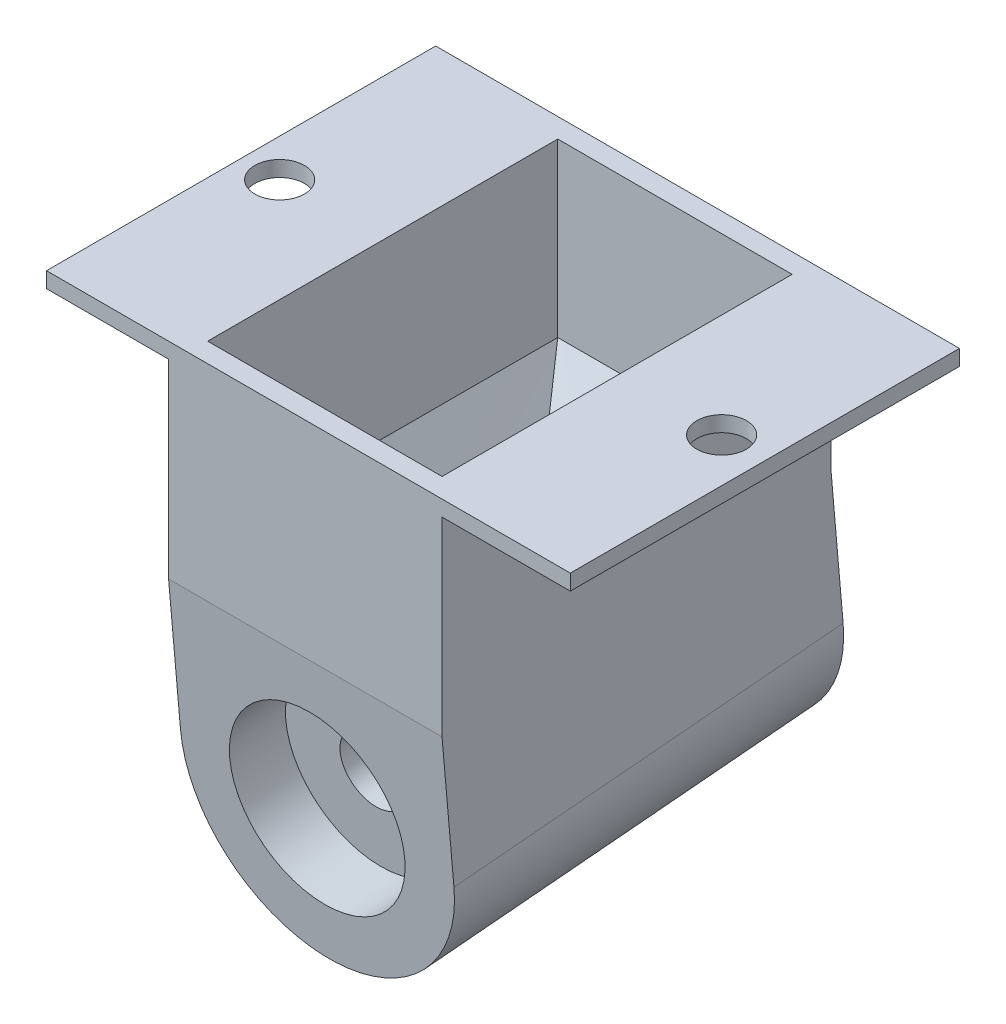
from build123d import *

# Parameters (mm, degrees)
BOSS_EXTRUDE2_DEPTH = 50
SKETCH19_R          = 4.25
CUT_EXTRUDE4_DEPTH  = 59.449844405
SKETCH20_R          = 11.2
CUT_EXTRUDE5_DEPTH  = 7.2
CUT_EXTRUDE6_START  = -7.2
SKETCH21_R          = 11.2
CUT_EXTRUDE6_DEPTH  = 7.2
SKETCH29_W          = 67.039204955
SKETCH29_H          = 49.809734905
SKETCH29_R          = 3.175
SKETCH29_W_2        = 30
SKETCH29_H_2        = 44.809734905
BOSS_EXTRUDE4_DEPTH = 2


with BuildPart() as part:
    # Sketch11 → Boss-Extrude2 (new body)
    with BuildSketch(Plane(origin=(0, 0, 0), x_dir=(-1, 0, 0), z_dir=(0, 0.08715574274765156, -0.9961946980917461))):
        with BuildLine():
            Line((-17.5, 0), (-17.5, 17.5))
            Line((-17.5, 17.5), (17.5, 17.5))
            Line((17.5, 17.5), (17.5, 0))
            ThreePointArc((17.5, 0), (0, -17.5), (-17.5, 0))
        make_face()
    extrude(amount=BOSS_EXTRUDE2_DEPTH)

    # Sketch19 → Cut-Extrude4 (cut, through all)
    with BuildSketch(Plane(origin=(0, 0, 0), x_dir=(1, 0, 0), z_dir=(0, -0.08715574274765156, 0.9961946980917461))):
        with Locations(Location((0, 0, 0), (0, 0, 270))):
            Circle(SKETCH19_R)
    extrude(amount=-CUT_EXTRUDE4_DEPTH, mode=Mode.SUBTRACT)

    # Sketch20 → Cut-Extrude5 (cut)
    with BuildSketch(Plane(origin=(0, 0, 0), x_dir=(1, 0, 0), z_dir=(0, -0.08715574274765156, 0.9961946980917461))):
        with Locations(Location((0, 0, 0), (0, 0, 270))):
            Circle(SKETCH20_R)
    extrude(amount=-CUT_EXTRUDE5_DEPTH, mode=Mode.SUBTRACT)

    # Sketch21 → Cut-Extrude6 (cut)
    with BuildSketch(Plane(origin=(0, 4.357787137, -49.809734905), x_dir=(-1, 0, 0), z_dir=(0, 0.08715574274765156, -0.9961946980917461)).offset(CUT_EXTRUDE6_START)):
        with Locations(Location((0, 0, 0), (0, 0, 270))):
            Circle(SKETCH21_R)
    extrude(amount=CUT_EXTRUDE6_DEPTH, mode=Mode.SUBTRACT)

    # Sketch23 → Loft3 section 0
    with BuildSketch(Plane(origin=(0, 17.433407217, 1.525225498), x_dir=(1, 0, 0), z_dir=(0, 0.9961946980917462, 0.08715574274765159))):
        with BuildLine():
            Line((17.5, 0), (17.5, 50))
            Line((17.5, 50), (-17.5, 50))
            Line((-17.5, 50), (-17.5, 0))
            Line((-17.5, 0), (17.5, 0))
        make_face()
    # Sketch24 → Loft3 section 1
    with BuildSketch(Plane(origin=(0, 41.791194354, 0), x_dir=(1, 0, 0), z_dir=(0, 1, 0))):
        with BuildLine():
            Line((17.5, -1.525225498), (17.5, 48.284509407))
            Line((17.5, 48.284509407), (-17.5, 48.284509407))
            Line((-17.5, 48.284509407), (-17.5, -1.525225498))
            Line((-17.5, -1.525225498), (17.5, -1.525225498))
        make_face()
    loft()

    # Sketch26 → Cut-Loft7 section 0
    with BuildSketch(Plane(origin=(0, 41.791194354, 0), x_dir=(1, 0, 0), z_dir=(0, 1, 0))):
        with BuildLine():
            Line((-15, 0.974774502), (15, 0.974774502))
            Line((15, 0.974774502), (15, 45.784509407))
            Line((15, 45.784509407), (-15, 45.784509407))
            Line((-15, 45.784509407), (-15, 0.974774502))
        make_face()
    # Sketch27 → Cut-Loft7 section 1
    with BuildSketch(Plane(origin=(0, 21.791194354, 0), x_dir=(1, 0, 0), z_dir=(0, 1, 0))):
        with BuildLine():
            Line((15, 0.974774502), (15, 45.784509407))
            Line((15, 45.784509407), (-15, 45.784509407))
            Line((-15, 45.784509407), (-15, 0.974774502))
            Line((-15, 0.974774502), (15, 0.974774502))
        make_face()
    loft(mode=Mode.SUBTRACT)

    # Cut-Loft8: read off the stored shape, not the designer's step
    # Cut-Loft8: loft between two sections, ruled curve by curve
    cut_loft8_from = [
        Edge.make_bspline([(2.4, 2.52751654, -28.889646245), (2.4, 2.544947688, -29.088885184), (2.37568, 2.564665803, -29.314264273), (2.23232, 2.607504594, -29.803913891), (2.112, 2.630708939, -30.069140767), (1.728, 2.675332679, -30.579192453), (1.461591696, 2.696640901, -30.822746545), (0.963321799, 2.719802012, -31.087479253), (0.781633136, 2.726029473, -31.158659456), (0.399905325, 2.734478939, -31.25523729), (0.2, 2.736690322, -31.28051352), (-0.2, 2.736690322, -31.28051352), (-0.399905325, 2.734478939, -31.25523729), (-0.781633136, 2.726029473, -31.158659456), (-0.963321799, 2.719802012, -31.087479253), (-1.461591696, 2.696640901, -30.822746545), (-1.728, 2.675332679, -30.579192453), (-2.112, 2.630708939, -30.069140767), (-2.23232, 2.607504594, -29.803913891), (-2.37568, 2.564665803, -29.314264273), (-2.4, 2.544947688, -29.088885184), (-2.4, 2.52751654, -28.889646245)], [0, 0, 0, 0, 0.125, 0.125, 0.25, 0.25, 0.375, 0.375, 0.4375, 0.4375, 0.5, 0.5, 0.5625, 0.5625, 0.625, 0.625, 0.75, 0.75, 0.875, 0.875, 1, 1, 1, 1], 3),
        Edge.make_bspline([(-2.4, 2.52751654, -28.889646245), (-2.4, 2.411308883, -27.561386647), (-2.4, 2.295101226, -26.23312705), (-2.4, 2.062685912, -23.576607855), (-2.4, 1.946478255, -22.248348257), (-2.4, 1.830270598, -20.92008866)], [0, 0, 0, 0, 0.5, 0.5, 1, 1, 1, 1], 3),
        Edge.make_bspline([(2.4, 1.830270598, -20.92008866), (2.4, 1.946478255, -22.248348257), (2.4, 2.062685912, -23.576607855), (2.4, 2.295101226, -26.23312705), (2.4, 2.411308883, -27.561386647), (2.4, 2.52751654, -28.889646245)], [0, 0, 0, 0, 0.5, 0.5, 1, 1, 1, 1], 3),
        Edge.make_bspline([(-2.4, 1.830270598, -20.92008866), (-2.4, 1.812839449, -20.72084972), (-2.37568, 1.793121334, -20.495470632), (-2.23232, 1.750282543, -20.005821014), (-2.112, 1.727078198, -19.740594137), (-1.728, 1.682454458, -19.230542452), (-1.461591696, 1.661146236, -18.98698836), (-0.963321799, 1.637985125, -18.722255651), (-0.781633136, 1.631757664, -18.651075448), (-0.399905325, 1.623308199, -18.554497614), (-0.2, 1.621096815, -18.529221385), (0.2, 1.621096815, -18.529221385), (0.399905325, 1.623308199, -18.554497614), (0.781633136, 1.631757664, -18.651075448), (0.963321799, 1.637985125, -18.722255651), (1.461591696, 1.661146236, -18.98698836), (1.728, 1.682454458, -19.230542452), (2.112, 1.727078198, -19.740594137), (2.23232, 1.750282543, -20.005821014), (2.37568, 1.793121334, -20.495470632), (2.4, 1.812839449, -20.72084972), (2.4, 1.830270598, -20.92008866)], [0, 0, 0, 0, 0.125, 0.125, 0.25, 0.25, 0.375, 0.375, 0.4375, 0.4375, 0.5, 0.5, 0.5625, 0.5625, 0.625, 0.625, 0.75, 0.75, 0.875, 0.875, 1, 1, 1, 1], 3),
    ]
    cut_loft8_to = [
        Edge.make_bspline([(15, 21.791194354, -45.784509407), (13.75, 21.791194354, -45.784509407), (12.5, 21.791194354, -45.784509407), (10, 21.791194354, -45.784509407), (8.75, 21.791194354, -45.784509407), (6.25, 21.791194354, -45.784509407), (5, 21.791194354, -45.784509407), (3.125, 21.791194354, -45.784509407), (2.5, 21.791194354, -45.784509407), (1.25, 21.791194354, -45.784509407), (0.625, 21.791194354, -45.784509407), (-0.625, 21.791194354, -45.784509407), (-1.25, 21.791194354, -45.784509407), (-2.5, 21.791194354, -45.784509407), (-3.125, 21.791194354, -45.784509407), (-5, 21.791194354, -45.784509407), (-6.25, 21.791194354, -45.784509407), (-8.75, 21.791194354, -45.784509407), (-10, 21.791194354, -45.784509407), (-12.5, 21.791194354, -45.784509407), (-13.75, 21.791194354, -45.784509407), (-15, 21.791194354, -45.784509407)], [0, 0, 0, 0, 0.125, 0.125, 0.25, 0.25, 0.375, 0.375, 0.4375, 0.4375, 0.5, 0.5, 0.5625, 0.5625, 0.625, 0.625, 0.75, 0.75, 0.875, 0.875, 1, 1, 1, 1], 3),
        Edge.make_bspline([(-15, 21.791194354, -45.784509407), (-15, 21.791194354, -38.316220256), (-15, 21.791194354, -30.847931105), (-15, 21.791194354, -15.911352803), (-15, 21.791194354, -8.443063653), (-15, 21.791194354, -0.974774502)], [0, 0, 0, 0, 0.5, 0.5, 1, 1, 1, 1], 3),
        Edge.make_bspline([(15, 21.791194354, -0.974774502), (15, 21.791194354, -8.443063653), (15, 21.791194354, -15.911352803), (15, 21.791194354, -30.847931105), (15, 21.791194354, -38.316220256), (15, 21.791194354, -45.784509407)], [0, 0, 0, 0, 0.5, 0.5, 1, 1, 1, 1], 3),
        Edge.make_bspline([(-15, 21.791194354, -0.974774502), (-13.75, 21.791194354, -0.974774502), (-12.5, 21.791194354, -0.974774502), (-10, 21.791194354, -0.974774502), (-8.75, 21.791194354, -0.974774502), (-6.25, 21.791194354, -0.974774502), (-5, 21.791194354, -0.974774502), (-3.125, 21.791194354, -0.974774502), (-2.5, 21.791194354, -0.974774502), (-1.25, 21.791194354, -0.974774502), (-0.625, 21.791194354, -0.974774502), (0.625, 21.791194354, -0.974774502), (1.25, 21.791194354, -0.974774502), (2.5, 21.791194354, -0.974774502), (3.125, 21.791194354, -0.974774502), (5, 21.791194354, -0.974774502), (6.25, 21.791194354, -0.974774502), (8.75, 21.791194354, -0.974774502), (10, 21.791194354, -0.974774502), (12.5, 21.791194354, -0.974774502), (13.75, 21.791194354, -0.974774502), (15, 21.791194354, -0.974774502)], [0, 0, 0, 0, 0.125, 0.125, 0.25, 0.25, 0.375, 0.375, 0.4375, 0.4375, 0.5, 0.5, 0.5625, 0.5625, 0.625, 0.625, 0.75, 0.75, 0.875, 0.875, 1, 1, 1, 1], 3),
    ]
    cut_loft8 = Solid(Shell([*[Face.make_surface_from_curves(cut_loft8_from[k], cut_loft8_to[k]) for k in range(4)], Face(Wire(cut_loft8_from)), Face(Wire(cut_loft8_to))]))
    add(cut_loft8, mode=Mode.SUBTRACT)

    # Sketch29 → Boss-Extrude4 (add)
    with BuildSketch(Plane(origin=(0, 41.791194354, 0), x_dir=(1, 0, 0), z_dir=(0, 1, 0))):
        with Locations((0.397406033, 23.379641955)):
            Rectangle(SKETCH29_W, SKETCH29_H)
        with Locations(Location((-28.284271247, 23.474774502, 0), (0, 0, 270))):
            Circle(SKETCH29_R, mode=Mode.SUBTRACT)
        with Locations(Location((28.284271247, 23.474774502, 0), (0, 0, 90))):
            Circle(SKETCH29_R, mode=Mode.SUBTRACT)
        with Locations((0, 23.379641955)):
            Rectangle(SKETCH29_W_2, SKETCH29_H_2, mode=Mode.SUBTRACT)
    extrude(amount=BOSS_EXTRUDE4_DEPTH)


solid = part.part
